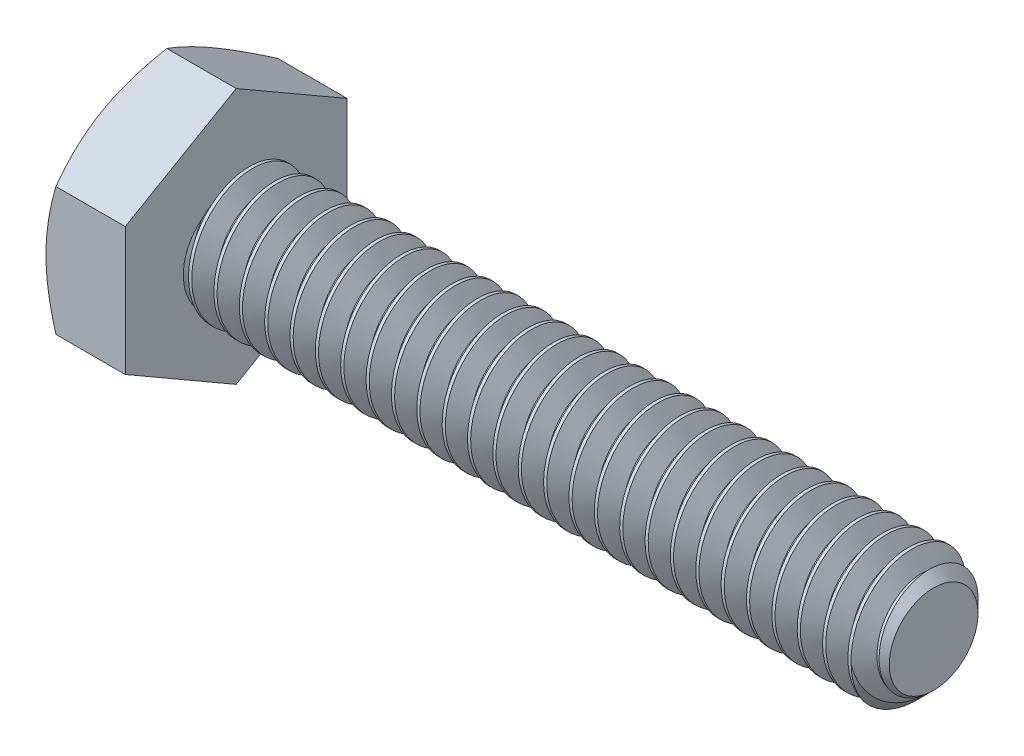
from build123d import *

# Parameters (mm, degrees)
SKETCH5_R           = 3.175
BOSS_EXTRUDE3_DEPTH = 34.925
CHAMFER1_SIZE       = 0.9525
CUT_SWEEP1_PITCH    = 1.27
BOSS_EXTRUDE4_DEPTH = 3.96875
SKETCH8_OUTSIDE_W   = 162.966
SKETCH8_OUTSIDE_H   = 164.686
SKETCH8_OUTSIDE_R   = 5.55625
CUT_EXTRUDE3_DEPTH  = 40.809022412
CUT_EXTRUDE3_DRAFT  = -60


with BuildPart() as part:
    # Sketch5 → Boss-Extrude3 (new body)
    with BuildSketch(Plane(origin=(19.446875, 0, 0), x_dir=(0, 0, -1), z_dir=(1, 0, 0))):
        Circle(SKETCH5_R)
    extrude(amount=-BOSS_EXTRUDE3_DEPTH)

    # Chamfer1
    chamfer1_edges = [part.edges().sort_by_distance(p)[0] for p in [
        (19.446875, 0, 3.175),
    ]]
    chamfer(chamfer1_edges, length=CHAMFER1_SIZE)

    # Cut-Sweep1: arcs per turn and ends read off the stored shape
    # Cut-Sweep1: the profile of Sketch10 profile screwed along a right-hand helix through 28.5 turns, 8 arcs to a turn; built about Z, then put on its axis
    cut_sweep1_z = Axis((0, 0, 0), (0, 0, 1))
    cut_sweep1_corners = [(3.1753, 0, 0.000173205), (2.350110803, 0, -0.47625), (2.350110803, 0, -0.635), (3.1753, 0, -1.111423205)]
    with BuildLine(mode=Mode.PRIVATE) as cut_sweep1_profile:
        Line(cut_sweep1_corners[0], cut_sweep1_corners[1])
        Line(cut_sweep1_corners[1], cut_sweep1_corners[2])
        Line(cut_sweep1_corners[2], cut_sweep1_corners[3])
        Line(cut_sweep1_corners[3], cut_sweep1_corners[0])
    cut_sweep1_cap = Face(cut_sweep1_profile.wire())
    cut_sweep1_turn_angles = [0, 22.5, 45, 67.5, 90, 112.5, 135, 157.5, 180, 202.5, 225, 247.5, 270, 292.5, 315, 337.5, 360]
    cut_sweep1_turn_weights = [1, 0.9238795325112867, 1, 0.9238795325112867, 1, 0.9238795325112867, 1, 0.9238795325112867, 1, 0.9238795325112867, 1, 0.9238795325112867, 1, 0.9238795325112867, 1, 0.9238795325112867, 1]
    cut_sweep1_turn_rails = [Edge.make_bspline([Vector(p[0], p[1], 0).rotate(cut_sweep1_z, cut_sweep1_turn_angles[k]) / cut_sweep1_turn_weights[k] + Vector(0, 0, p[2] + CUT_SWEEP1_PITCH * cut_sweep1_turn_angles[k] / 360) for k in range(17)], [0, 0, 0, 1, 1, 2, 2, 3, 3, 4, 4, 5, 5, 6, 6, 7, 7, 8, 8, 8], 2, cut_sweep1_turn_weights) for p in cut_sweep1_corners]
    cut_sweep1_turn_sides = [Face.make_surface_from_curves(cut_sweep1_turn_rails[p[0]], cut_sweep1_turn_rails[p[1]]) for p in [(0, 1), (1, 2), (2, 3), (3, 0)]]
    cut_sweep1_last_angles = [10080, 10102.5, 10125, 10147.5, 10170, 10192.5, 10215, 10237.5, 10260]
    cut_sweep1_last_weights = [1, 0.9238795325112867, 1, 0.9238795325112867, 1, 0.9238795325112867, 1, 0.923879532510983, 1]
    cut_sweep1_last_rails = [Edge.make_bspline([Vector(p[0], p[1], 0).rotate(cut_sweep1_z, cut_sweep1_last_angles[k]) / cut_sweep1_last_weights[k] + Vector(0, 0, p[2] + CUT_SWEEP1_PITCH * cut_sweep1_last_angles[k] / 360) for k in range(9)], [0, 0, 0, 1, 1, 2, 2, 3, 3, 4, 4, 4], 2, cut_sweep1_last_weights) for p in cut_sweep1_corners]
    cut_sweep1_last_sides = [Face.make_surface_from_curves(cut_sweep1_last_rails[p[0]], cut_sweep1_last_rails[p[1]]) for p in [(0, 1), (1, 2), (2, 3), (3, 0)]]
    cut_sweep1 = Plane(origin=(19.446875, 0, 0), x_dir=(0, 1, 0), z_dir=(-1, 0, 0)) * Solid(Shell([*[p.moved(Location((0, 0, CUT_SWEEP1_PITCH * i))) for i in range(28) for p in cut_sweep1_turn_sides], *cut_sweep1_last_sides, cut_sweep1_cap, cut_sweep1_cap.rotate(cut_sweep1_z, 10260).moved(Location((0, 0, CUT_SWEEP1_PITCH * 10260 / 360)))]))
    add(cut_sweep1, mode=Mode.SUBTRACT)

    # Sketch6 → Boss-Extrude4 (add)
    with BuildSketch(Plane.ZY.offset(15.478125)):
        Polygon((5.55625, 3.207902433), (0, 6.415804866), (-5.55625, 3.207902433), (-5.55625, -3.207902433), (0, -6.415804866), (5.55625, -3.207902433), align=None)
    extrude(amount=BOSS_EXTRUDE4_DEPTH)


with BuildPart() as cut_extrude3_tool:
    # Sketch8 outside → Cut-Extrude3 (with draft: the straight prism first)
    with BuildSketch(Plane.ZY.offset(19.446875)):
        Rectangle(SKETCH8_OUTSIDE_W, SKETCH8_OUTSIDE_H)
        Circle(SKETCH8_OUTSIDE_R, mode=Mode.SUBTRACT)
    extrude(amount=-CUT_EXTRUDE3_DEPTH)
    # Cut-Extrude3: the draft: its side faces are tilted about the plane it starts from
    cut_extrude3_sides = [cut_extrude3_tool.faces().sort_by_distance(p)[0] for p in [
        (0.957636206, -82.343, 0),
        (0.957636206, 0, 81.483),
        (0.957636206, 82.343, 0),
        (0.957636206, 0, -81.483),
        (0.957636206, 0, -5.55625),
    ]]
    draft(cut_extrude3_sides, Plane.ZY.offset(19.446875), CUT_EXTRUDE3_DRAFT)


with BuildPart() as part_1:
    add(part.part)

    # Cut-Extrude3: cut by cut_extrude3_tool
    add(cut_extrude3_tool.part, mode=Mode.SUBTRACT)


solid = part_1.part
